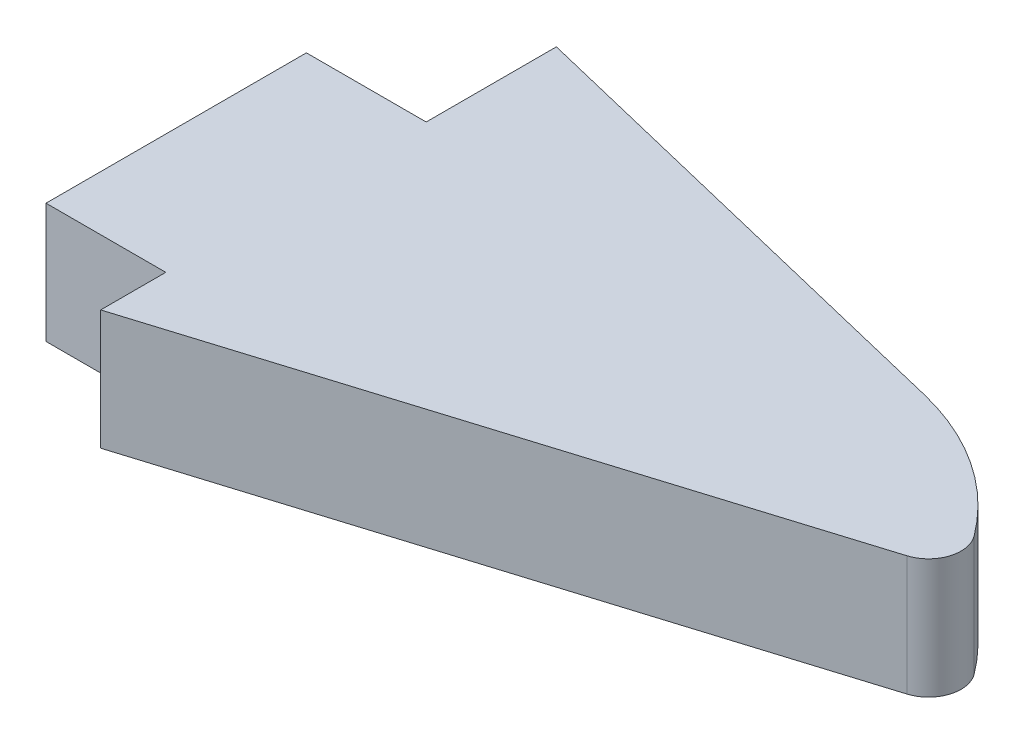
from build123d import *

# Parameters (mm, degrees)
BOSS_EXTRUDE1_DEPTH = 5.842
FILLET1_R           = 12.7
FILLET2_R           = 1.5875


with BuildPart() as part:
    # Sketch1 → Boss-Extrude1 (new body)
    with BuildSketch(Plane(origin=(0, 0, 0), x_dir=(1, 0, 0), z_dir=(0, 1, 0))):
        Polygon((34.925, 0.357309717), (34.925, 4.964553254), (2.921, 12.7), (2.921, 6.35), (-2.921, 6.35), (-2.921, -6.35), (2.921, -6.35), (2.921, -9.525), align=None)
    extrude(amount=BOSS_EXTRUDE1_DEPTH)

    # Fillet1
    # the kernel refuses this fillet: 12.7 mm, written as the material it takes off along each edge
    with BuildSketch(Plane(origin=(34.925, -21.492812716, -4.964553254), x_dir=(0, 0, 1), z_dir=(0, 1, 0))) as fillet1_piece_1:
        with BuildLine():
            CenterArc((10.324747541, -11.340200526), FILLET1_R, 116.756334597, 49.655734511)
            Line((-2.019785945, -8.356495946), (-2.266676614, -8.296821854))
            Line((-2.266676614, -8.296821854), (-0.24689067, 0.059674092))
            Line((-0.24689067, 0.059674092), (0, 0.254))
            ThreePointArc((0, 0.254), (2.303621769, 0.254), (4.492893457, 0.226804011))
            Line((4.492893457, 0.226804011), (4.607243537, 0))
        make_face()
    extrude(amount=48.827625432, mode=Mode.SUBTRACT)

    # Fillet2
    fillet2_edges = [part.edges().sort_by_distance(p)[0] for p in [
        (34.925, 2.921, -0.357309717),
    ]]
    fillet(fillet2_edges, radius=FILLET2_R)


solid = part.part
